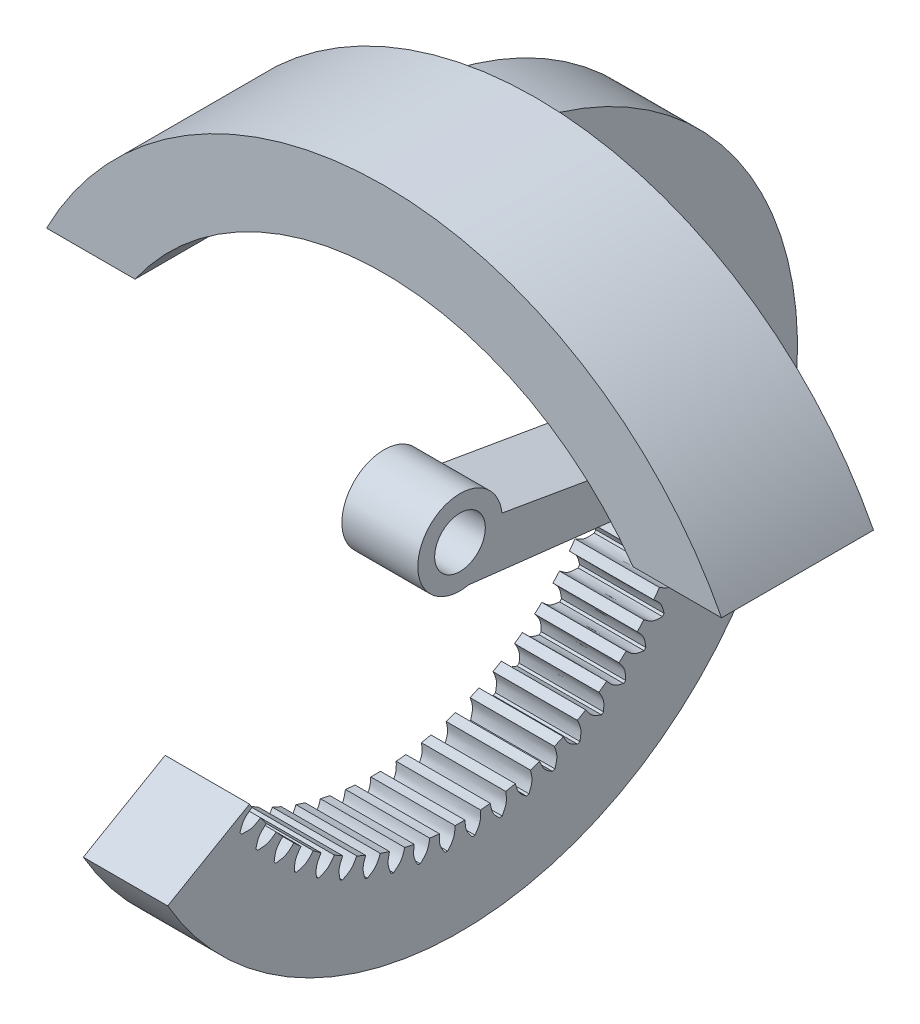
from build123d import *

# Parameters (mm, degrees)
KUGGLUCKA_DEPTH          = 15
CIRPATTERN_COUNT         = 60
SKETCH1_R                = 40
BOSS_EXTRUDE1_DEPTH      = 10
COMBINE3_START           = -12.5
COMBINE3_DEPTH           = 25
CUT_EXTRUDE1_DEPTH       = 10
BOSS_EXTRUDE2_DEPTH      = 9
BOSS_EXTRUDE2_DEPTH_BACK = 9
SKETCH4_R                = 5
BOSS_EXTRUDE3_DEPTH      = 9
BOSS_EXTRUDE4_DEPTH      = 9
SKETCH6_R                = 3
CUT_EXTRUDE2_DEPTH       = 9


# Read off the part's stored shape, not the designer's step: Combine3
with BuildPart() as part:
    # Ritning 1 → Kugghjulsämne (revolve)
    with BuildSketch(Plane.XY, mode=Mode.PRIVATE) as kugghjuls_mne_sk:
        Polygon((-12.5, -9.5), (12.5, -9.5), (12.5, 4.5), (2.5, 4.5), (2.5, 15.5), (-12.5, 15.5), align=None)
    revolve(kugghjuls_mne_sk.sketch.rotate(Axis((-12.5, -15.5, 0), (1, 0, 0)), 90), axis=Axis((-12.5, -15.5, 0), (1, 0, 0)))

    # Ritning 2 → Kugglucka (cut)
    with BuildSketch(Plane.ZY.offset(12.5)):
        with BuildLine():
            Line((1.468439282, 15.465201212), (0, 16.933640493))
            Line((0, 16.933640493), (-1.468439282, 15.465201212))
            add(Edge.make_bspline(
                [(-1.468439282, 15.465201212), (-1.201451518, 15.156321595), (-0.662309062, 14.532584713), (-0.604027899, 13.709668563), (-0.574608045, 13.294267235)],
                knots=[0, 0, 0, 0, 0.495208197, 1, 1, 1, 1], degree=3))
            ThreePointArc((-0.574608045, 13.294267235), (0, 13.3), (0.574608045, 13.294267235))
            add(Edge.make_bspline(
                [(1.468439282, 15.465201212), (1.201451518, 15.156321595), (0.662309062, 14.532584713), (0.604027899, 13.709668563), (0.574608045, 13.294267235)],
                knots=[0, 0, 0, 0, 0.495208197, 1, 1, 1, 1], degree=3))
        make_face()
    kugglucka = extrude(amount=-KUGGLUCKA_DEPTH, mode=Mode.SUBTRACT)

    # CirPattern: Kugglucka ×60 about axis
    cirpattern_axis = Axis((-12.5, -15.5, 0), (-1, 0, 0))
    for i in range(1, CIRPATTERN_COUNT):
        add(kugglucka.rotate(cirpattern_axis, i * 360 / CIRPATTERN_COUNT), mode=Mode.SUBTRACT)


with BuildPart() as body_2:
    # Sketch1 → Boss-Extrude1 (new body)
    with BuildSketch(Plane.ZY.offset(12.5)):
        with Locations((0, -15.5)):
            Circle(SKETCH1_R)
    extrude(amount=-BOSS_EXTRUDE1_DEPTH)


with BuildPart() as combine3_tool:
    # Combine3 outline → Combine3 (new body)
    with BuildSketch(Plane.YZ.offset(COMBINE3_START)):
        with BuildLine():
            ThreePointArc((13.294267235, -0.574608045), (13.3, 0), (13.294267235, 0.574608045))
            add(Edge.make_bspline(
                [(13.294267235, 0.574608045), (13.709668563, 0.604027899), (14.532584713, 0.662309062), (15.156321595, 1.201451518), (15.465201212, 1.468439282)],
                knots=[0, 0, 0, 0, 0.504791803, 1, 1, 1, 1], degree=3))
            ThreePointArc((15.465201212, 1.468439282), (15.457515577, 1.622414644), (15.449064301, 1.77634988))
            add(Edge.make_bspline(
                [(15.449064301, 1.77634988), (15.113968939, 2.009588344), (14.437293221, 2.480579064), (13.61279305, 2.452522797), (13.196592122, 2.438360223)],
                knots=[0, 0, 0, 0, 0.495208197, 1, 1, 1, 1], degree=3))
            ThreePointArc((13.196592122, 2.438360223), (13.142230587, 3.010419742), (13.07646633, 3.581280787))
            add(Edge.make_bspline(
                [(13.07646633, 3.581280787), (13.486516834, 3.653960738), (14.298832924, 3.797940792), (14.862797177, 4.399328027), (15.142076898, 4.697139915)],
                knots=[0, 0, 0, 0, 0.504791803, 1, 1, 1, 1], degree=3))
            ThreePointArc((15.142076898, 4.697139915), (15.118338558, 4.849468416), (15.093842965, 5.00167698))
            add(Edge.make_bspline(
                [(15.093842965, 5.00167698), (14.736203232, 5.198610737), (14.014002478, 5.596289447), (13.196951685, 5.482203139), (12.784511141, 5.424613306)],
                knots=[0, 0, 0, 0, 0.495208197, 1, 1, 1, 1], degree=3))
            ThreePointArc((12.784511141, 5.424613306), (12.670650901, 5.987856695), (12.54557568, 6.548716267))
            add(Edge.make_bspline(
                [(12.54557568, 6.548716267), (12.945782761, 6.663860019), (13.738598884, 6.891961488), (14.236611599, 7.549004577), (14.483231577, 7.874377701)],
                knots=[0, 0, 0, 0, 0.504791803, 1, 1, 1, 1], degree=3))
            ThreePointArc((14.483231577, 7.874377701), (14.443700615, 8.023390398), (14.403429084, 8.172204661))
            add(Edge.make_bspline(
                [(14.403429084, 8.172204661), (14.027163356, 8.330676062), (13.267350149, 8.650685712), (12.466700511, 8.451819317), (12.062539137, 8.35143319)],
                knots=[0, 0, 0, 0, 0.495208197, 1, 1, 1, 1], degree=3))
            ThreePointArc((12.062539137, 8.35143319), (11.890427669, 8.899689438), (11.707411835, 9.444402642))
            add(Edge.make_bspline(
                [(11.707411835, 9.444402642), (12.09339074, 9.600748655), (12.858020637, 9.910472411), (13.284625482, 10.615972654), (13.495883697, 10.965342156)],
                knots=[0, 0, 0, 0, 0.504791803, 1, 1, 1, 1], degree=3))
            ThreePointArc((13.495883697, 10.965342156), (13.440993221, 11.109406436), (13.385386976, 11.253195957))
            add(Edge.make_bspline(
                [(13.385386976, 11.253195957), (12.994617699, 11.371468757), (12.205516711, 11.610303254), (11.430040315, 11.328835593), (11.038586186, 11.186753025)],
                knots=[0, 0, 0, 0, 0.495208197, 1, 1, 1, 1], degree=3))
            ThreePointArc((11.038586186, 11.186753025), (10.81010918, 11.714015321), (10.571157891, 12.236614165))
            add(Edge.make_bspline(
                [(10.571157891, 12.236614165), (10.938679755, 12.43244948), (11.666745982, 12.820402125), (12.017268984, 13.566629912), (12.190850848, 13.936168029)],
                knots=[0, 0, 0, 0, 0.504791803, 1, 1, 1, 1], degree=3))
            ThreePointArc((12.190850848, 13.936168029), (12.12120225, 14.073705492), (12.050870523, 14.210894884))
            add(Edge.make_bspline(
                [(12.050870523, 14.210894884), (11.649879047, 14.287673261), (10.840135834, 14.442715884), (10.098328961, 14.081730776), (9.723870931, 13.899508453)],
                knots=[0, 0, 0, 0, 0.495208197, 1, 1, 1, 1], degree=3))
            ThreePointArc((9.723870931, 13.899508453), (9.441531629, 14.4), (9.149262886, 14.894758782))
            add(Edge.make_bspline(
                [(9.149262886, 14.894758782), (9.494301062, 15.127937786), (10.177826772, 15.58986883), (10.448427529, 16.368648334), (10.582431242, 16.754306328)],
                knots=[0, 0, 0, 0, 0.504791803, 1, 1, 1, 1], degree=3))
            ThreePointArc((10.582431242, 16.754306328), (10.498787606, 16.883810085), (10.414500968, 17.012896272))
            add(Edge.make_bspline(
                [(10.414500968, 17.012896272), (10.00768064, 17.047339027), (9.186166918, 17.116891096), (8.486156958, 16.68034357), (8.132797668, 16.459977958)],
                knots=[0, 0, 0, 0, 0.495208197, 1, 1, 1, 1], degree=3))
            ThreePointArc((8.132797668, 16.459977958), (7.799689438, 16.928215266), (7.457305399, 17.389713305))
            add(Edge.make_bspline(
                [(7.457305399, 17.389713305), (7.776079576, 17.657681241), (8.407575919, 18.18852967), (8.595289672, 18.99132842), (8.688247061, 19.388880941)],
                knots=[0, 0, 0, 0, 0.504791803, 1, 1, 1, 1], degree=3))
            ThreePointArc((8.688247061, 19.388880941), (8.591524805, 19.508932123), (8.494206717, 19.628500809))
            add(Edge.make_bspline(
                [(8.494206717, 19.628500809), (8.086014745, 19.620230579), (7.26173119, 19.603530067), (6.611187601, 19.096203029), (6.282798529, 18.840108499)],
                knots=[0, 0, 0, 0, 0.495208197, 1, 1, 1, 1], degree=3))
            ThreePointArc((6.282798529, 18.840108499), (5.902570974, 19.270961463), (5.513822869, 19.69414249))
            add(Edge.make_bspline(
                [(5.513822869, 19.69414249), (5.802840492, 19.993963444), (6.375388661, 20.587913172), (6.478158779, 21.405935537), (6.529051383, 21.811026917)],
                knots=[0, 0, 0, 0, 0.504791803, 1, 1, 1, 1], degree=3))
            ThreePointArc((6.529051383, 21.811026917), (6.420310217, 21.920310217), (6.311026917, 22.029051383))
            add(Edge.make_bspline(
                [(6.311026917, 22.029051383), (5.905935537, 21.978158779), (5.087913172, 21.875388661), (4.493963444, 21.302840492), (4.19414249, 21.013822869)],
                knots=[0, 0, 0, 0, 0.495208197, 1, 1, 1, 1], degree=3))
            ThreePointArc((4.19414249, 21.013822869), (3.770961463, 21.402570974), (3.340108499, 21.782798529))
            add(Edge.make_bspline(
                [(3.340108499, 21.782798529), (3.596203029, 22.111187601), (4.103530067, 22.76173119), (4.120230579, 23.586014745), (4.128500809, 23.994206717)],
                knots=[0, 0, 0, 0, 0.504791803, 1, 1, 1, 1], degree=3))
            ThreePointArc((4.128500809, 23.994206717), (4.008932123, 24.091524805), (3.888880941, 24.188247061))
            add(Edge.make_bspline(
                [(3.888880941, 24.188247061), (3.49132842, 24.095289672), (2.68852967, 23.907575919), (2.157681241, 23.276079576), (1.889713305, 22.957305399)],
                knots=[0, 0, 0, 0, 0.495208197, 1, 1, 1, 1], degree=3))
            ThreePointArc((1.889713305, 22.957305399), (1.428215266, 23.299689438), (0.959977958, 23.632797668))
            add(Edge.make_bspline(
                [(0.959977958, 23.632797668), (1.18034357, 23.986156958), (1.616891096, 24.686166918), (1.547339027, 25.50768064), (1.512896272, 25.914500968)],
                knots=[0, 0, 0, 0, 0.504791803, 1, 1, 1, 1], degree=3))
            ThreePointArc((1.512896272, 25.914500968), (1.383810085, 25.998787606), (1.254306328, 26.082431242))
            add(Edge.make_bspline(
                [(1.254306328, 26.082431242), (0.868648334, 25.948427529), (0.08986883, 25.677826772), (-0.372062214, 24.994301062), (-0.605241218, 24.649262886)],
                knots=[0, 0, 0, 0, 0.495208197, 1, 1, 1, 1], degree=3))
            ThreePointArc((-0.605241218, 24.649262886), (-1.1, 24.941531629), (-1.600491547, 25.223870931))
            add(Edge.make_bspline(
                [(-1.600491547, 25.223870931), (-1.418269224, 25.598328961), (-1.057284116, 26.340135834), (-1.212326739, 27.149879047), (-1.289105116, 27.550870523)],
                knots=[0, 0, 0, 0, 0.504791803, 1, 1, 1, 1], degree=3))
            ThreePointArc((-1.289105116, 27.550870523), (-1.426294508, 27.62120225), (-1.563831971, 27.690850848))
            add(Edge.make_bspline(
                [(-1.563831971, 27.690850848), (-1.933370088, 27.517268984), (-2.679597875, 27.166745982), (-3.06755052, 26.438679755), (-3.263385835, 26.071157891)],
                knots=[0, 0, 0, 0, 0.495208197, 1, 1, 1, 1], degree=3))
            ThreePointArc((-3.263385835, 26.071157891), (-3.785984679, 26.31010918), (-4.313246975, 26.538586186))
            add(Edge.make_bspline(
                [(-4.313246975, 26.538586186), (-4.171164407, 26.930040315), (-3.889696746, 27.705516711), (-4.128531243, 28.494617699), (-4.246804043, 28.885386976)],
                knots=[0, 0, 0, 0, 0.504791803, 1, 1, 1, 1], degree=3))
            ThreePointArc((-4.246804043, 28.885386976), (-4.390593564, 28.940993221), (-4.534657844, 28.995883697))
            add(Edge.make_bspline(
                [(-4.534657844, 28.995883697), (-4.884027346, 28.784625482), (-5.589527589, 28.358020637), (-5.899251345, 27.59339074), (-6.055597358, 27.207411835)],
                knots=[0, 0, 0, 0, 0.495208197, 1, 1, 1, 1], degree=3))
            ThreePointArc((-6.055597358, 27.207411835), (-6.600310562, 27.390427669), (-7.14856681, 27.562539137))
            add(Edge.make_bspline(
                [(-7.14856681, 27.562539137), (-7.048180683, 27.966700511), (-6.849314288, 28.767350149), (-7.169323938, 29.527163356), (-7.327795339, 29.903429084)],
                knots=[0, 0, 0, 0, 0.504791803, 1, 1, 1, 1], degree=3))
            ThreePointArc((-7.327795339, 29.903429084), (-7.476609602, 29.943700615), (-7.625622299, 29.983231577))
            add(Edge.make_bspline(
                [(-7.625622299, 29.983231577), (-7.950995423, 29.736611599), (-8.608038512, 29.238598884), (-8.836139981, 28.445782761), (-8.951283733, 28.04557568)],
                knots=[0, 0, 0, 0, 0.495208197, 1, 1, 1, 1], degree=3))
            ThreePointArc((-8.951283733, 28.04557568), (-9.512143305, 28.170650901), (-10.075386694, 28.284511141))
            add(Edge.make_bspline(
                [(-10.075386694, 28.284511141), (-10.017796861, 28.696951685), (-9.903710553, 29.514002478), (-10.301389263, 30.236203232), (-10.49832302, 30.593842965)],
                knots=[0, 0, 0, 0, 0.504791803, 1, 1, 1, 1], degree=3))
            ThreePointArc((-10.49832302, 30.593842965), (-10.650531584, 30.618338558), (-10.802860085, 30.642076898))
            add(Edge.make_bspline(
                [(-10.802860085, 30.642076898), (-11.100671973, 30.362797177), (-11.702059208, 29.798832924), (-11.846039262, 28.986516834), (-11.918719213, 28.57646633)],
                knots=[0, 0, 0, 0, 0.495208197, 1, 1, 1, 1], degree=3))
            ThreePointArc((-11.918719213, 28.57646633), (-12.489580258, 28.642230587), (-13.061639777, 28.696592122))
            add(Edge.make_bspline(
                [(-13.061639777, 28.696592122), (-13.047477203, 29.11279305), (-13.019420936, 29.937293221), (-13.490411656, 30.613968939), (-13.72365012, 30.949064301)],
                knots=[0, 0, 0, 0, 0.504791803, 1, 1, 1, 1], degree=3))
            ThreePointArc((-13.72365012, 30.949064301), (-13.877585356, 30.957515577), (-14.031560718, 30.965201212))
            add(Edge.make_bspline(
                [(-14.031560718, 30.965201212), (-14.298548482, 30.656321595), (-14.837690938, 30.032584713), (-14.895972101, 29.209668563), (-14.925391955, 28.794267235)],
                knots=[0, 0, 0, 0, 0.495208197, 1, 1, 1, 1], degree=3))
            ThreePointArc((-14.925391955, 28.794267235), (-15.5, 28.8), (-16.074608045, 28.794267235))
            add(Edge.make_bspline(
                [(-16.074608045, 28.794267235), (-16.104027899, 29.209668563), (-16.162309062, 30.032584713), (-16.701451518, 30.656321595), (-16.968439282, 30.965201212)],
                knots=[0, 0, 0, 0, 0.504791803, 1, 1, 1, 1], degree=3))
            ThreePointArc((-16.968439282, 30.965201212), (-17.122414644, 30.957515577), (-17.27634988, 30.949064301))
            add(Edge.make_bspline(
                [(-17.27634988, 30.949064301), (-17.509588344, 30.613968939), (-17.980579064, 29.937293221), (-17.952522797, 29.11279305), (-17.938360223, 28.696592122)],
                knots=[0, 0, 0, 0, 0.495208197, 1, 1, 1, 1], degree=3))
            ThreePointArc((-17.938360223, 28.696592122), (-18.510419742, 28.642230587), (-19.081280787, 28.57646633))
            add(Edge.make_bspline(
                [(-19.081280787, 28.57646633), (-19.153960738, 28.986516834), (-19.297940792, 29.798832924), (-19.899328027, 30.362797177), (-20.197139915, 30.642076898)],
                knots=[0, 0, 0, 0, 0.504791803, 1, 1, 1, 1], degree=3))
            ThreePointArc((-20.197139915, 30.642076898), (-20.349468416, 30.618338558), (-20.50167698, 30.593842965))
            add(Edge.make_bspline(
                [(-20.50167698, 30.593842965), (-20.698610737, 30.236203232), (-21.096289447, 29.514002478), (-20.982203139, 28.696951685), (-20.924613306, 28.284511141)],
                knots=[0, 0, 0, 0, 0.495208197, 1, 1, 1, 1], degree=3))
            ThreePointArc((-20.924613306, 28.284511141), (-21.487856695, 28.170650901), (-22.048716267, 28.04557568))
            add(Edge.make_bspline(
                [(-22.048716267, 28.04557568), (-22.163860019, 28.445782761), (-22.391961488, 29.238598884), (-23.049004577, 29.736611599), (-23.374377701, 29.983231577)],
                knots=[0, 0, 0, 0, 0.504791803, 1, 1, 1, 1], degree=3))
            ThreePointArc((-23.374377701, 29.983231577), (-23.523390398, 29.943700615), (-23.672204661, 29.903429084))
            add(Edge.make_bspline(
                [(-23.672204661, 29.903429084), (-23.830676062, 29.527163356), (-24.150685712, 28.767350149), (-23.951819317, 27.966700511), (-23.85143319, 27.562539137)],
                knots=[0, 0, 0, 0, 0.495208197, 1, 1, 1, 1], degree=3))
            ThreePointArc((-23.85143319, 27.562539137), (-24.399689438, 27.390427669), (-24.944402642, 27.207411835))
            add(Edge.make_bspline(
                [(-24.944402642, 27.207411835), (-25.100748655, 27.59339074), (-25.410472411, 28.358020637), (-26.115972654, 28.784625482), (-26.465342156, 28.995883697)],
                knots=[0, 0, 0, 0, 0.504791803, 1, 1, 1, 1], degree=3))
            ThreePointArc((-26.465342156, 28.995883697), (-26.609406436, 28.940993221), (-26.753195957, 28.885386976))
            add(Edge.make_bspline(
                [(-26.753195957, 28.885386976), (-26.871468757, 28.494617699), (-27.110303254, 27.705516711), (-26.828835593, 26.930040315), (-26.686753025, 26.538586186)],
                knots=[0, 0, 0, 0, 0.495208197, 1, 1, 1, 1], degree=3))
            ThreePointArc((-26.686753025, 26.538586186), (-27.214015321, 26.31010918), (-27.736614165, 26.071157891))
            add(Edge.make_bspline(
                [(-27.736614165, 26.071157891), (-27.93244948, 26.438679755), (-28.320402125, 27.166745982), (-29.066629912, 27.517268984), (-29.436168029, 27.690850848)],
                knots=[0, 0, 0, 0, 0.504791803, 1, 1, 1, 1], degree=3))
            ThreePointArc((-29.436168029, 27.690850848), (-29.573705492, 27.62120225), (-29.710894884, 27.550870523))
            add(Edge.make_bspline(
                [(-29.710894884, 27.550870523), (-29.787673261, 27.149879047), (-29.942715884, 26.340135834), (-29.581730776, 25.598328961), (-29.399508453, 25.223870931)],
                knots=[0, 0, 0, 0, 0.495208197, 1, 1, 1, 1], degree=3))
            ThreePointArc((-29.399508453, 25.223870931), (-29.9, 24.941531629), (-30.394758782, 24.649262886))
            add(Edge.make_bspline(
                [(-30.394758782, 24.649262886), (-30.627937786, 24.994301062), (-31.08986883, 25.677826772), (-31.868648334, 25.948427529), (-32.254306328, 26.082431242)],
                knots=[0, 0, 0, 0, 0.504791803, 1, 1, 1, 1], degree=3))
            ThreePointArc((-32.254306328, 26.082431242), (-32.383810085, 25.998787606), (-32.512896272, 25.914500968))
            add(Edge.make_bspline(
                [(-32.512896272, 25.914500968), (-32.547339027, 25.50768064), (-32.616891096, 24.686166918), (-32.18034357, 23.986156958), (-31.959977958, 23.632797668)],
                knots=[0, 0, 0, 0, 0.495208197, 1, 1, 1, 1], degree=3))
            ThreePointArc((-31.959977958, 23.632797668), (-32.428215266, 23.299689438), (-32.889713305, 22.957305399))
            add(Edge.make_bspline(
                [(-32.889713305, 22.957305399), (-33.157681241, 23.276079576), (-33.68852967, 23.907575919), (-34.49132842, 24.095289672), (-34.888880941, 24.188247061)],
                knots=[0, 0, 0, 0, 0.504791803, 1, 1, 1, 1], degree=3))
            ThreePointArc((-34.888880941, 24.188247061), (-35.008932123, 24.091524805), (-35.128500809, 23.994206717))
            add(Edge.make_bspline(
                [(-35.128500809, 23.994206717), (-35.120230579, 23.586014745), (-35.103530067, 22.76173119), (-34.596203029, 22.111187601), (-34.340108499, 21.782798529)],
                knots=[0, 0, 0, 0, 0.495208197, 1, 1, 1, 1], degree=3))
            ThreePointArc((-34.340108499, 21.782798529), (-34.770961463, 21.402570974), (-35.19414249, 21.013822869))
            add(Edge.make_bspline(
                [(-35.19414249, 21.013822869), (-35.493963444, 21.302840492), (-36.087913172, 21.875388661), (-36.905935537, 21.978158779), (-37.311026917, 22.029051383)],
                knots=[0, 0, 0, 0, 0.504791803, 1, 1, 1, 1], degree=3))
            ThreePointArc((-37.311026917, 22.029051383), (-37.420310217, 21.920310217), (-37.529051383, 21.811026917))
            add(Edge.make_bspline(
                [(-37.529051383, 21.811026917), (-37.478158779, 21.405935537), (-37.375388661, 20.587913172), (-36.802840492, 19.993963444), (-36.513822869, 19.69414249)],
                knots=[0, 0, 0, 0, 0.495208197, 1, 1, 1, 1], degree=3))
            ThreePointArc((-36.513822869, 19.69414249), (-36.902570974, 19.270961463), (-37.282798529, 18.840108499))
            add(Edge.make_bspline(
                [(-37.282798529, 18.840108499), (-37.611187601, 19.096203029), (-38.26173119, 19.603530067), (-39.086014745, 19.620230579), (-39.494206717, 19.628500809)],
                knots=[0, 0, 0, 0, 0.504791803, 1, 1, 1, 1], degree=3))
            ThreePointArc((-39.494206717, 19.628500809), (-39.591524805, 19.508932123), (-39.688247061, 19.388880941))
            add(Edge.make_bspline(
                [(-39.688247061, 19.388880941), (-39.595289672, 18.99132842), (-39.407575919, 18.18852967), (-38.776079576, 17.657681241), (-38.457305399, 17.389713305)],
                knots=[0, 0, 0, 0, 0.495208197, 1, 1, 1, 1], degree=3))
            ThreePointArc((-38.457305399, 17.389713305), (-38.799689438, 16.928215266), (-39.132797668, 16.459977958))
            add(Edge.make_bspline(
                [(-39.132797668, 16.459977958), (-39.486156958, 16.68034357), (-40.186166918, 17.116891096), (-41.00768064, 17.047339027), (-41.414500968, 17.012896272)],
                knots=[0, 0, 0, 0, 0.504791803, 1, 1, 1, 1], degree=3))
            ThreePointArc((-41.414500968, 17.012896272), (-41.498787606, 16.883810085), (-41.582431242, 16.754306328))
            add(Edge.make_bspline(
                [(-41.582431242, 16.754306328), (-41.448427529, 16.368648334), (-41.177826772, 15.58986883), (-40.494301062, 15.127937786), (-40.149262886, 14.894758782)],
                knots=[0, 0, 0, 0, 0.495208197, 1, 1, 1, 1], degree=3))
            ThreePointArc((-40.149262886, 14.894758782), (-40.441531629, 14.4), (-40.723870931, 13.899508453))
            add(Edge.make_bspline(
                [(-40.723870931, 13.899508453), (-41.098328961, 14.081730776), (-41.840135834, 14.442715884), (-42.649879047, 14.287673261), (-43.050870523, 14.210894884)],
                knots=[0, 0, 0, 0, 0.504791803, 1, 1, 1, 1], degree=3))
            ThreePointArc((-43.050870523, 14.210894884), (-43.12120225, 14.073705492), (-43.190850848, 13.936168029))
            add(Edge.make_bspline(
                [(-43.190850848, 13.936168029), (-43.017268984, 13.566629912), (-42.666745982, 12.820402125), (-41.938679755, 12.43244948), (-41.571157891, 12.236614165)],
                knots=[0, 0, 0, 0, 0.495208197, 1, 1, 1, 1], degree=3))
            ThreePointArc((-41.571157891, 12.236614165), (-41.81010918, 11.714015321), (-42.038586186, 11.186753025))
            add(Edge.make_bspline(
                [(-42.038586186, 11.186753025), (-42.430040315, 11.328835593), (-43.205516711, 11.610303254), (-43.994617699, 11.371468757), (-44.385386976, 11.253195957)],
                knots=[0, 0, 0, 0, 0.504791803, 1, 1, 1, 1], degree=3))
            ThreePointArc((-44.385386976, 11.253195957), (-44.440993221, 11.109406436), (-44.495883697, 10.965342156))
            add(Edge.make_bspline(
                [(-44.495883697, 10.965342156), (-44.284625482, 10.615972654), (-43.858020637, 9.910472411), (-43.09339074, 9.600748655), (-42.707411835, 9.444402642)],
                knots=[0, 0, 0, 0, 0.495208197, 1, 1, 1, 1], degree=3))
            ThreePointArc((-42.707411835, 9.444402642), (-42.890427669, 8.899689438), (-43.062539137, 8.35143319))
            add(Edge.make_bspline(
                [(-43.062539137, 8.35143319), (-43.466700511, 8.451819317), (-44.267350149, 8.650685712), (-45.027163356, 8.330676062), (-45.403429084, 8.172204661)],
                knots=[0, 0, 0, 0, 0.504791803, 1, 1, 1, 1], degree=3))
            ThreePointArc((-45.403429084, 8.172204661), (-45.443700615, 8.023390398), (-45.483231577, 7.874377701))
            add(Edge.make_bspline(
                [(-45.483231577, 7.874377701), (-45.236611599, 7.549004577), (-44.738598884, 6.891961488), (-43.945782761, 6.663860019), (-43.54557568, 6.548716267)],
                knots=[0, 0, 0, 0, 0.495208197, 1, 1, 1, 1], degree=3))
            ThreePointArc((-43.54557568, 6.548716267), (-43.670650901, 5.987856695), (-43.784511141, 5.424613306))
            add(Edge.make_bspline(
                [(-43.784511141, 5.424613306), (-44.196951685, 5.482203139), (-45.014002478, 5.596289447), (-45.736203232, 5.198610737), (-46.093842965, 5.00167698)],
                knots=[0, 0, 0, 0, 0.504791803, 1, 1, 1, 1], degree=3))
            ThreePointArc((-46.093842965, 5.00167698), (-46.118338558, 4.849468416), (-46.142076898, 4.697139915))
            add(Edge.make_bspline(
                [(-46.142076898, 4.697139915), (-45.862797177, 4.399328027), (-45.298832924, 3.797940792), (-44.486516834, 3.653960738), (-44.07646633, 3.581280787)],
                knots=[0, 0, 0, 0, 0.495208197, 1, 1, 1, 1], degree=3))
            ThreePointArc((-44.07646633, 3.581280787), (-44.142230587, 3.010419742), (-44.196592122, 2.438360223))
            add(Edge.make_bspline(
                [(-44.196592122, 2.438360223), (-44.61279305, 2.452522797), (-45.437293221, 2.480579064), (-46.113968939, 2.009588344), (-46.449064301, 1.77634988)],
                knots=[0, 0, 0, 0, 0.504791803, 1, 1, 1, 1], degree=3))
            ThreePointArc((-46.449064301, 1.77634988), (-46.457515577, 1.622414644), (-46.465201212, 1.468439282))
            add(Edge.make_bspline(
                [(-46.465201212, 1.468439282), (-46.156321595, 1.201451518), (-45.532584713, 0.662309062), (-44.709668563, 0.604027899), (-44.294267235, 0.574608045)],
                knots=[0, 0, 0, 0, 0.495208197, 1, 1, 1, 1], degree=3))
            ThreePointArc((-44.294267235, 0.574608045), (-44.3, 0), (-44.294267235, -0.574608045))
            add(Edge.make_bspline(
                [(-44.294267235, -0.574608045), (-44.709668563, -0.604027899), (-45.532584713, -0.662309062), (-46.156321595, -1.201451518), (-46.465201212, -1.468439282)],
                knots=[0, 0, 0, 0, 0.504791803, 1, 1, 1, 1], degree=3))
            ThreePointArc((-46.465201212, -1.468439282), (-46.457515577, -1.622414644), (-46.449064301, -1.77634988))
            add(Edge.make_bspline(
                [(-46.449064301, -1.77634988), (-46.113968939, -2.009588344), (-45.437293221, -2.480579064), (-44.61279305, -2.452522797), (-44.196592122, -2.438360223)],
                knots=[0, 0, 0, 0, 0.495208197, 1, 1, 1, 1], degree=3))
            ThreePointArc((-44.196592122, -2.438360223), (-44.142230587, -3.010419742), (-44.07646633, -3.581280787))
            add(Edge.make_bspline(
                [(-44.07646633, -3.581280787), (-44.486516834, -3.653960738), (-45.298832924, -3.797940792), (-45.862797177, -4.399328027), (-46.142076898, -4.697139915)],
                knots=[0, 0, 0, 0, 0.504791803, 1, 1, 1, 1], degree=3))
            ThreePointArc((-46.142076898, -4.697139915), (-46.118338558, -4.849468416), (-46.093842965, -5.00167698))
            add(Edge.make_bspline(
                [(-46.093842965, -5.00167698), (-45.736203232, -5.198610737), (-45.014002478, -5.596289447), (-44.196951685, -5.482203139), (-43.784511141, -5.424613306)],
                knots=[0, 0, 0, 0, 0.495208197, 1, 1, 1, 1], degree=3))
            ThreePointArc((-43.784511141, -5.424613306), (-43.670650901, -5.987856695), (-43.54557568, -6.548716267))
            add(Edge.make_bspline(
                [(-43.54557568, -6.548716267), (-43.945782761, -6.663860019), (-44.738598884, -6.891961488), (-45.236611599, -7.549004577), (-45.483231577, -7.874377701)],
                knots=[0, 0, 0, 0, 0.504791803, 1, 1, 1, 1], degree=3))
            ThreePointArc((-45.483231577, -7.874377701), (-45.443700615, -8.023390398), (-45.403429084, -8.172204661))
            add(Edge.make_bspline(
                [(-45.403429084, -8.172204661), (-45.027163356, -8.330676062), (-44.267350149, -8.650685712), (-43.466700511, -8.451819317), (-43.062539137, -8.35143319)],
                knots=[0, 0, 0, 0, 0.495208197, 1, 1, 1, 1], degree=3))
            ThreePointArc((-43.062539137, -8.35143319), (-42.890427669, -8.899689438), (-42.707411835, -9.444402642))
            add(Edge.make_bspline(
                [(-42.707411835, -9.444402642), (-43.09339074, -9.600748655), (-43.858020637, -9.910472411), (-44.284625482, -10.615972654), (-44.495883697, -10.965342156)],
                knots=[0, 0, 0, 0, 0.504791803, 1, 1, 1, 1], degree=3))
            ThreePointArc((-44.495883697, -10.965342156), (-44.440993221, -11.109406436), (-44.385386976, -11.253195957))
            add(Edge.make_bspline(
                [(-44.385386976, -11.253195957), (-43.994617699, -11.371468757), (-43.205516711, -11.610303254), (-42.430040315, -11.328835593), (-42.038586186, -11.186753025)],
                knots=[0, 0, 0, 0, 0.495208197, 1, 1, 1, 1], degree=3))
            ThreePointArc((-42.038586186, -11.186753025), (-41.81010918, -11.714015321), (-41.571157891, -12.236614165))
            add(Edge.make_bspline(
                [(-41.571157891, -12.236614165), (-41.938679755, -12.43244948), (-42.666745982, -12.820402125), (-43.017268984, -13.566629912), (-43.190850848, -13.936168029)],
                knots=[0, 0, 0, 0, 0.504791803, 1, 1, 1, 1], degree=3))
            ThreePointArc((-43.190850848, -13.936168029), (-43.12120225, -14.073705492), (-43.050870523, -14.210894884))
            add(Edge.make_bspline(
                [(-43.050870523, -14.210894884), (-42.649879047, -14.287673261), (-41.840135834, -14.442715884), (-41.098328961, -14.081730776), (-40.723870931, -13.899508453)],
                knots=[0, 0, 0, 0, 0.495208197, 1, 1, 1, 1], degree=3))
            ThreePointArc((-40.723870931, -13.899508453), (-40.441531629, -14.4), (-40.149262886, -14.894758782))
            add(Edge.make_bspline(
                [(-40.149262886, -14.894758782), (-40.494301062, -15.127937786), (-41.177826772, -15.58986883), (-41.448427529, -16.368648334), (-41.582431242, -16.754306328)],
                knots=[0, 0, 0, 0, 0.504791803, 1, 1, 1, 1], degree=3))
            ThreePointArc((-41.582431242, -16.754306328), (-41.498787606, -16.883810085), (-41.414500968, -17.012896272))
            add(Edge.make_bspline(
                [(-41.414500968, -17.012896272), (-41.00768064, -17.047339027), (-40.186166918, -17.116891096), (-39.486156958, -16.68034357), (-39.132797668, -16.459977958)],
                knots=[0, 0, 0, 0, 0.495208197, 1, 1, 1, 1], degree=3))
            ThreePointArc((-39.132797668, -16.459977958), (-38.799689438, -16.928215266), (-38.457305399, -17.389713305))
            add(Edge.make_bspline(
                [(-38.457305399, -17.389713305), (-38.776079576, -17.657681241), (-39.407575919, -18.18852967), (-39.595289672, -18.99132842), (-39.688247061, -19.388880941)],
                knots=[0, 0, 0, 0, 0.504791803, 1, 1, 1, 1], degree=3))
            ThreePointArc((-39.688247061, -19.388880941), (-39.591524805, -19.508932123), (-39.494206717, -19.628500809))
            add(Edge.make_bspline(
                [(-39.494206717, -19.628500809), (-39.086014745, -19.620230579), (-38.26173119, -19.603530067), (-37.611187601, -19.096203029), (-37.282798529, -18.840108499)],
                knots=[0, 0, 0, 0, 0.495208197, 1, 1, 1, 1], degree=3))
            ThreePointArc((-37.282798529, -18.840108499), (-36.902570974, -19.270961463), (-36.513822869, -19.69414249))
            add(Edge.make_bspline(
                [(-36.513822869, -19.69414249), (-36.802840492, -19.993963444), (-37.375388661, -20.587913172), (-37.478158779, -21.405935537), (-37.529051383, -21.811026917)],
                knots=[0, 0, 0, 0, 0.504791803, 1, 1, 1, 1], degree=3))
            ThreePointArc((-37.529051383, -21.811026917), (-37.420310217, -21.920310217), (-37.311026917, -22.029051383))
            add(Edge.make_bspline(
                [(-37.311026917, -22.029051383), (-36.905935537, -21.978158779), (-36.087913172, -21.875388661), (-35.493963444, -21.302840492), (-35.19414249, -21.013822869)],
                knots=[0, 0, 0, 0, 0.495208197, 1, 1, 1, 1], degree=3))
            ThreePointArc((-35.19414249, -21.013822869), (-34.770961463, -21.402570974), (-34.340108499, -21.782798529))
            add(Edge.make_bspline(
                [(-34.340108499, -21.782798529), (-34.596203029, -22.111187601), (-35.103530067, -22.76173119), (-35.120230579, -23.586014745), (-35.128500809, -23.994206717)],
                knots=[0, 0, 0, 0, 0.504791803, 1, 1, 1, 1], degree=3))
            ThreePointArc((-35.128500809, -23.994206717), (-35.008932123, -24.091524805), (-34.888880941, -24.188247061))
            add(Edge.make_bspline(
                [(-34.888880941, -24.188247061), (-34.49132842, -24.095289672), (-33.68852967, -23.907575919), (-33.157681241, -23.276079576), (-32.889713305, -22.957305399)],
                knots=[0, 0, 0, 0, 0.495208197, 1, 1, 1, 1], degree=3))
            ThreePointArc((-32.889713305, -22.957305399), (-32.428215266, -23.299689438), (-31.959977958, -23.632797668))
            add(Edge.make_bspline(
                [(-31.959977958, -23.632797668), (-32.18034357, -23.986156958), (-32.616891096, -24.686166918), (-32.547339027, -25.50768064), (-32.512896272, -25.914500968)],
                knots=[0, 0, 0, 0, 0.504791803, 1, 1, 1, 1], degree=3))
            ThreePointArc((-32.512896272, -25.914500968), (-32.383810085, -25.998787606), (-32.254306328, -26.082431242))
            add(Edge.make_bspline(
                [(-32.254306328, -26.082431242), (-31.868648334, -25.948427529), (-31.08986883, -25.677826772), (-30.627937786, -24.994301062), (-30.394758782, -24.649262886)],
                knots=[0, 0, 0, 0, 0.495208197, 1, 1, 1, 1], degree=3))
            ThreePointArc((-30.394758782, -24.649262886), (-29.9, -24.941531629), (-29.399508453, -25.223870931))
            add(Edge.make_bspline(
                [(-29.399508453, -25.223870931), (-29.581730776, -25.598328961), (-29.942715884, -26.340135834), (-29.787673261, -27.149879047), (-29.710894884, -27.550870523)],
                knots=[0, 0, 0, 0, 0.504791803, 1, 1, 1, 1], degree=3))
            ThreePointArc((-29.710894884, -27.550870523), (-29.573705492, -27.62120225), (-29.436168029, -27.690850848))
            add(Edge.make_bspline(
                [(-29.436168029, -27.690850848), (-29.066629912, -27.517268984), (-28.320402125, -27.166745982), (-27.93244948, -26.438679755), (-27.736614165, -26.071157891)],
                knots=[0, 0, 0, 0, 0.495208197, 1, 1, 1, 1], degree=3))
            ThreePointArc((-27.736614165, -26.071157891), (-27.214015321, -26.31010918), (-26.686753025, -26.538586186))
            add(Edge.make_bspline(
                [(-26.686753025, -26.538586186), (-26.828835593, -26.930040315), (-27.110303254, -27.705516711), (-26.871468757, -28.494617699), (-26.753195957, -28.885386976)],
                knots=[0, 0, 0, 0, 0.504791803, 1, 1, 1, 1], degree=3))
            ThreePointArc((-26.753195957, -28.885386976), (-26.609406436, -28.940993221), (-26.465342156, -28.995883697))
            add(Edge.make_bspline(
                [(-26.465342156, -28.995883697), (-26.115972654, -28.784625482), (-25.410472411, -28.358020637), (-25.100748655, -27.59339074), (-24.944402642, -27.207411835)],
                knots=[0, 0, 0, 0, 0.495208197, 1, 1, 1, 1], degree=3))
            ThreePointArc((-24.944402642, -27.207411835), (-24.399689438, -27.390427669), (-23.85143319, -27.562539137))
            add(Edge.make_bspline(
                [(-23.85143319, -27.562539137), (-23.951819317, -27.966700511), (-24.150685712, -28.767350149), (-23.830676062, -29.527163356), (-23.672204661, -29.903429084)],
                knots=[0, 0, 0, 0, 0.504791803, 1, 1, 1, 1], degree=3))
            ThreePointArc((-23.672204661, -29.903429084), (-23.523390398, -29.943700615), (-23.374377701, -29.983231577))
            add(Edge.make_bspline(
                [(-23.374377701, -29.983231577), (-23.049004577, -29.736611599), (-22.391961488, -29.238598884), (-22.163860019, -28.445782761), (-22.048716267, -28.04557568)],
                knots=[0, 0, 0, 0, 0.495208197, 1, 1, 1, 1], degree=3))
            ThreePointArc((-22.048716267, -28.04557568), (-21.487856695, -28.170650901), (-20.924613306, -28.284511141))
            add(Edge.make_bspline(
                [(-20.924613306, -28.284511141), (-20.982203139, -28.696951685), (-21.096289447, -29.514002478), (-20.698610737, -30.236203232), (-20.50167698, -30.593842965)],
                knots=[0, 0, 0, 0, 0.504791803, 1, 1, 1, 1], degree=3))
            ThreePointArc((-20.50167698, -30.593842965), (-20.349468416, -30.618338558), (-20.197139915, -30.642076898))
            add(Edge.make_bspline(
                [(-20.197139915, -30.642076898), (-19.899328027, -30.362797177), (-19.297940792, -29.798832924), (-19.153960738, -28.986516834), (-19.081280787, -28.57646633)],
                knots=[0, 0, 0, 0, 0.495208197, 1, 1, 1, 1], degree=3))
            ThreePointArc((-19.081280787, -28.57646633), (-18.510419742, -28.642230587), (-17.938360223, -28.696592122))
            add(Edge.make_bspline(
                [(-17.938360223, -28.696592122), (-17.952522797, -29.11279305), (-17.980579064, -29.937293221), (-17.509588344, -30.613968939), (-17.27634988, -30.949064301)],
                knots=[0, 0, 0, 0, 0.504791803, 1, 1, 1, 1], degree=3))
            ThreePointArc((-17.27634988, -30.949064301), (-17.122414644, -30.957515577), (-16.968439282, -30.965201212))
            add(Edge.make_bspline(
                [(-16.968439282, -30.965201212), (-16.701451518, -30.656321595), (-16.162309062, -30.032584713), (-16.104027899, -29.209668563), (-16.074608045, -28.794267235)],
                knots=[0, 0, 0, 0, 0.495208197, 1, 1, 1, 1], degree=3))
            ThreePointArc((-16.074608045, -28.794267235), (-15.5, -28.8), (-14.925391955, -28.794267235))
            add(Edge.make_bspline(
                [(-14.925391955, -28.794267235), (-14.895972101, -29.209668563), (-14.837690938, -30.032584713), (-14.298548482, -30.656321595), (-14.031560718, -30.965201212)],
                knots=[0, 0, 0, 0, 0.504791803, 1, 1, 1, 1], degree=3))
            ThreePointArc((-14.031560718, -30.965201212), (-13.877585356, -30.957515577), (-13.72365012, -30.949064301))
            add(Edge.make_bspline(
                [(-13.72365012, -30.949064301), (-13.490411656, -30.613968939), (-13.019420936, -29.937293221), (-13.047477203, -29.11279305), (-13.061639777, -28.696592122)],
                knots=[0, 0, 0, 0, 0.495208197, 1, 1, 1, 1], degree=3))
            ThreePointArc((-13.061639777, -28.696592122), (-12.489580258, -28.642230587), (-11.918719213, -28.57646633))
            add(Edge.make_bspline(
                [(-11.918719213, -28.57646633), (-11.846039262, -28.986516834), (-11.702059208, -29.798832924), (-11.100671973, -30.362797177), (-10.802860085, -30.642076898)],
                knots=[0, 0, 0, 0, 0.504791803, 1, 1, 1, 1], degree=3))
            ThreePointArc((-10.802860085, -30.642076898), (-10.650531584, -30.618338558), (-10.49832302, -30.593842965))
            add(Edge.make_bspline(
                [(-10.49832302, -30.593842965), (-10.301389263, -30.236203232), (-9.903710553, -29.514002478), (-10.017796861, -28.696951685), (-10.075386694, -28.284511141)],
                knots=[0, 0, 0, 0, 0.495208197, 1, 1, 1, 1], degree=3))
            ThreePointArc((-10.075386694, -28.284511141), (-9.512143305, -28.170650901), (-8.951283733, -28.04557568))
            add(Edge.make_bspline(
                [(-8.951283733, -28.04557568), (-8.836139981, -28.445782761), (-8.608038512, -29.238598884), (-7.950995423, -29.736611599), (-7.625622299, -29.983231577)],
                knots=[0, 0, 0, 0, 0.504791803, 1, 1, 1, 1], degree=3))
            ThreePointArc((-7.625622299, -29.983231577), (-7.476609602, -29.943700615), (-7.327795339, -29.903429084))
            add(Edge.make_bspline(
                [(-7.327795339, -29.903429084), (-7.169323938, -29.527163356), (-6.849314288, -28.767350149), (-7.048180683, -27.966700511), (-7.14856681, -27.562539137)],
                knots=[0, 0, 0, 0, 0.495208197, 1, 1, 1, 1], degree=3))
            ThreePointArc((-7.14856681, -27.562539137), (-6.600310562, -27.390427669), (-6.055597358, -27.207411835))
            add(Edge.make_bspline(
                [(-6.055597358, -27.207411835), (-5.899251345, -27.59339074), (-5.589527589, -28.358020637), (-4.884027346, -28.784625482), (-4.534657844, -28.995883697)],
                knots=[0, 0, 0, 0, 0.504791803, 1, 1, 1, 1], degree=3))
            ThreePointArc((-4.534657844, -28.995883697), (-4.390593564, -28.940993221), (-4.246804043, -28.885386976))
            add(Edge.make_bspline(
                [(-4.246804043, -28.885386976), (-4.128531243, -28.494617699), (-3.889696746, -27.705516711), (-4.171164407, -26.930040315), (-4.313246975, -26.538586186)],
                knots=[0, 0, 0, 0, 0.495208197, 1, 1, 1, 1], degree=3))
            ThreePointArc((-4.313246975, -26.538586186), (-3.785984679, -26.31010918), (-3.263385835, -26.071157891))
            add(Edge.make_bspline(
                [(-3.263385835, -26.071157891), (-3.06755052, -26.438679755), (-2.679597875, -27.166745982), (-1.933370088, -27.517268984), (-1.563831971, -27.690850848)],
                knots=[0, 0, 0, 0, 0.504791803, 1, 1, 1, 1], degree=3))
            ThreePointArc((-1.563831971, -27.690850848), (-1.426294508, -27.62120225), (-1.289105116, -27.550870523))
            add(Edge.make_bspline(
                [(-1.289105116, -27.550870523), (-1.212326739, -27.149879047), (-1.057284116, -26.340135834), (-1.418269224, -25.598328961), (-1.600491547, -25.223870931)],
                knots=[0, 0, 0, 0, 0.495208197, 1, 1, 1, 1], degree=3))
            ThreePointArc((-1.600491547, -25.223870931), (-1.1, -24.941531629), (-0.605241218, -24.649262886))
            add(Edge.make_bspline(
                [(-0.605241218, -24.649262886), (-0.372062214, -24.994301062), (0.08986883, -25.677826772), (0.868648334, -25.948427529), (1.254306328, -26.082431242)],
                knots=[0, 0, 0, 0, 0.504791803, 1, 1, 1, 1], degree=3))
            ThreePointArc((1.254306328, -26.082431242), (1.383810085, -25.998787606), (1.512896272, -25.914500968))
            add(Edge.make_bspline(
                [(1.512896272, -25.914500968), (1.547339027, -25.50768064), (1.616891096, -24.686166918), (1.18034357, -23.986156958), (0.959977958, -23.632797668)],
                knots=[0, 0, 0, 0, 0.495208197, 1, 1, 1, 1], degree=3))
            ThreePointArc((0.959977958, -23.632797668), (1.428215266, -23.299689438), (1.889713305, -22.957305399))
            add(Edge.make_bspline(
                [(1.889713305, -22.957305399), (2.157681241, -23.276079576), (2.68852967, -23.907575919), (3.49132842, -24.095289672), (3.888880941, -24.188247061)],
                knots=[0, 0, 0, 0, 0.504791803, 1, 1, 1, 1], degree=3))
            ThreePointArc((3.888880941, -24.188247061), (4.008932123, -24.091524805), (4.128500809, -23.994206717))
            add(Edge.make_bspline(
                [(4.128500809, -23.994206717), (4.120230579, -23.586014745), (4.103530067, -22.76173119), (3.596203029, -22.111187601), (3.340108499, -21.782798529)],
                knots=[0, 0, 0, 0, 0.495208197, 1, 1, 1, 1], degree=3))
            ThreePointArc((3.340108499, -21.782798529), (3.770961463, -21.402570974), (4.19414249, -21.013822869))
            add(Edge.make_bspline(
                [(4.19414249, -21.013822869), (4.493963444, -21.302840492), (5.087913172, -21.875388661), (5.905935537, -21.978158779), (6.311026917, -22.029051383)],
                knots=[0, 0, 0, 0, 0.504791803, 1, 1, 1, 1], degree=3))
            ThreePointArc((6.311026917, -22.029051383), (6.420310217, -21.920310217), (6.529051383, -21.811026917))
            add(Edge.make_bspline(
                [(6.529051383, -21.811026917), (6.478158779, -21.405935537), (6.375388661, -20.587913172), (5.802840492, -19.993963444), (5.513822869, -19.69414249)],
                knots=[0, 0, 0, 0, 0.495208197, 1, 1, 1, 1], degree=3))
            ThreePointArc((5.513822869, -19.69414249), (5.902570974, -19.270961463), (6.282798529, -18.840108499))
            add(Edge.make_bspline(
                [(6.282798529, -18.840108499), (6.611187601, -19.096203029), (7.26173119, -19.603530067), (8.086014745, -19.620230579), (8.494206717, -19.628500809)],
                knots=[0, 0, 0, 0, 0.504791803, 1, 1, 1, 1], degree=3))
            ThreePointArc((8.494206717, -19.628500809), (8.591524805, -19.508932123), (8.688247061, -19.388880941))
            add(Edge.make_bspline(
                [(8.688247061, -19.388880941), (8.595289672, -18.99132842), (8.407575919, -18.18852967), (7.776079576, -17.657681241), (7.457305399, -17.389713305)],
                knots=[0, 0, 0, 0, 0.495208197, 1, 1, 1, 1], degree=3))
            ThreePointArc((7.457305399, -17.389713305), (7.799689438, -16.928215266), (8.132797668, -16.459977958))
            add(Edge.make_bspline(
                [(8.132797668, -16.459977958), (8.486156958, -16.68034357), (9.186166918, -17.116891096), (10.00768064, -17.047339027), (10.414500968, -17.012896272)],
                knots=[0, 0, 0, 0, 0.504791803, 1, 1, 1, 1], degree=3))
            ThreePointArc((10.414500968, -17.012896272), (10.498787606, -16.883810085), (10.582431242, -16.754306328))
            add(Edge.make_bspline(
                [(10.582431242, -16.754306328), (10.448427529, -16.368648334), (10.177826772, -15.58986883), (9.494301062, -15.127937786), (9.149262886, -14.894758782)],
                knots=[0, 0, 0, 0, 0.495208197, 1, 1, 1, 1], degree=3))
            ThreePointArc((9.149262886, -14.894758782), (9.441531629, -14.4), (9.723870931, -13.899508453))
            add(Edge.make_bspline(
                [(9.723870931, -13.899508453), (10.098328961, -14.081730776), (10.840135834, -14.442715884), (11.649879047, -14.287673261), (12.050870523, -14.210894884)],
                knots=[0, 0, 0, 0, 0.504791803, 1, 1, 1, 1], degree=3))
            ThreePointArc((12.050870523, -14.210894884), (12.12120225, -14.073705492), (12.190850848, -13.936168029))
            add(Edge.make_bspline(
                [(12.190850848, -13.936168029), (12.017268984, -13.566629912), (11.666745982, -12.820402125), (10.938679755, -12.43244948), (10.571157891, -12.236614165)],
                knots=[0, 0, 0, 0, 0.495208197, 1, 1, 1, 1], degree=3))
            ThreePointArc((10.571157891, -12.236614165), (10.81010918, -11.714015321), (11.038586186, -11.186753025))
            add(Edge.make_bspline(
                [(11.038586186, -11.186753025), (11.430040315, -11.328835593), (12.205516711, -11.610303254), (12.994617699, -11.371468757), (13.385386976, -11.253195957)],
                knots=[0, 0, 0, 0, 0.504791803, 1, 1, 1, 1], degree=3))
            ThreePointArc((13.385386976, -11.253195957), (13.440993221, -11.109406436), (13.495883697, -10.965342156))
            add(Edge.make_bspline(
                [(13.495883697, -10.965342156), (13.284625482, -10.615972654), (12.858020637, -9.910472411), (12.09339074, -9.600748655), (11.707411835, -9.444402642)],
                knots=[0, 0, 0, 0, 0.495208197, 1, 1, 1, 1], degree=3))
            ThreePointArc((11.707411835, -9.444402642), (11.890427669, -8.899689438), (12.062539137, -8.35143319))
            add(Edge.make_bspline(
                [(12.062539137, -8.35143319), (12.466700511, -8.451819317), (13.267350149, -8.650685712), (14.027163356, -8.330676062), (14.403429084, -8.172204661)],
                knots=[0, 0, 0, 0, 0.504791803, 1, 1, 1, 1], degree=3))
            ThreePointArc((14.403429084, -8.172204661), (14.443700615, -8.023390398), (14.483231577, -7.874377701))
            add(Edge.make_bspline(
                [(14.483231577, -7.874377701), (14.236611599, -7.549004577), (13.738598884, -6.891961488), (12.945782761, -6.663860019), (12.54557568, -6.548716267)],
                knots=[0, 0, 0, 0, 0.495208197, 1, 1, 1, 1], degree=3))
            ThreePointArc((12.54557568, -6.548716267), (12.670650901, -5.987856695), (12.784511141, -5.424613306))
            add(Edge.make_bspline(
                [(12.784511141, -5.424613306), (13.196951685, -5.482203139), (14.014002478, -5.596289447), (14.736203232, -5.198610737), (15.093842965, -5.00167698)],
                knots=[0, 0, 0, 0, 0.504791803, 1, 1, 1, 1], degree=3))
            ThreePointArc((15.093842965, -5.00167698), (15.118338558, -4.849468416), (15.142076898, -4.697139915))
            add(Edge.make_bspline(
                [(15.142076898, -4.697139915), (14.862797177, -4.399328027), (14.298832924, -3.797940792), (13.486516834, -3.653960738), (13.07646633, -3.581280787)],
                knots=[0, 0, 0, 0, 0.495208197, 1, 1, 1, 1], degree=3))
            ThreePointArc((13.07646633, -3.581280787), (13.142230587, -3.010419742), (13.196592122, -2.438360223))
            add(Edge.make_bspline(
                [(13.196592122, -2.438360223), (13.61279305, -2.452522797), (14.437293221, -2.480579064), (15.113968939, -2.009588344), (15.449064301, -1.77634988)],
                knots=[0, 0, 0, 0, 0.504791803, 1, 1, 1, 1], degree=3))
            ThreePointArc((15.449064301, -1.77634988), (15.457515577, -1.622414644), (15.465201212, -1.468439282))
            add(Edge.make_bspline(
                [(15.465201212, -1.468439282), (15.156321595, -1.201451518), (14.532584713, -0.662309062), (13.709668563, -0.604027899), (13.294267235, -0.574608045)],
                knots=[0, 0, 0, 0, 0.495208197, 1, 1, 1, 1], degree=3))
        make_face()
    extrude(amount=COMBINE3_DEPTH)


with BuildPart() as part_1:
    add(part.part)

    # Combine3: cut by combine3_tool
    add(combine3_tool.part, mode=Mode.SUBTRACT)


with BuildPart() as body_2_1:
    add(body_2.part)

    # Combine3: cut by combine3_tool
    add(combine3_tool.part, mode=Mode.SUBTRACT)

    # Sketch2 → Cut-Extrude1 (cut)
    with BuildSketch(Plane(origin=(-2.5, 0, 0), x_dir=(0, 0, -1), z_dir=(1, 0, 0))):
        Polygon((0, 28.23683177), (0, -15.5), (-56.004097121, -47.833980548), (-67.354720926, -47.833980548), (-70.058452345, 28.23683177), align=None)
    extrude(amount=-CUT_EXTRUDE1_DEPTH, mode=Mode.SUBTRACT)

    # Sketch3 → Boss-Extrude2 (add, two sides: drawn at the far end of the back side and taken through both)
    with BuildSketch(Plane.XY.offset(-BOSS_EXTRUDE2_DEPTH_BACK)):
        with BuildLine():
            Line((-42.5, 1.240706191), (-32.012709127, 1.240706191))
            ThreePointArc((-32.012709127, 1.240706191), (-2.5, 16.625178063), (27.012709127, 1.240706191))
            Line((27.012709127, 1.240706191), (37.5, 1.240706191))
            ThreePointArc((37.5, 1.240706191), (-2.5, 25.625178063), (-42.5, 1.240706191))
        make_face()
    extrude(amount=BOSS_EXTRUDE2_DEPTH + BOSS_EXTRUDE2_DEPTH_BACK)



with BuildPart() as body_2_2:
    # Sketch4 → Boss-Extrude3 (new body)
    with BuildSketch(Plane(origin=(-2.5, 0, 0), x_dir=(0, 0, -1), z_dir=(1, 0, 0))):
        with Locations((0, -15.5)):
            Circle(SKETCH4_R)
    extrude(amount=-BOSS_EXTRUDE3_DEPTH)


with BuildPart() as body_2_3:
    add(body_2_1.part)

    add(body_2_2.part)  # Boss-Extrude4 merges body 2 2
    # Sketch5 → Boss-Extrude4 (add)
    with BuildSketch(Plane(origin=(-2.5, 0, 0), x_dir=(0, 0, -1), z_dir=(1, 0, 0))):
        Polygon((2.063492225, -14.489411188), (33.199477003, -19.865408559), (32.485226158, -24.002111367), (1.044749095, -20.389631819), align=None)
    extrude(amount=-BOSS_EXTRUDE4_DEPTH)

    # Sketch6 → Cut-Extrude2 (cut)
    with BuildSketch(Plane(origin=(-2.5, 0, 0), x_dir=(0, 0, -1), z_dir=(1, 0, 0))):
        with Locations((0, -15.5)):
            Circle(SKETCH6_R)
    extrude(amount=-CUT_EXTRUDE2_DEPTH, mode=Mode.SUBTRACT)


solid = body_2_3.part
